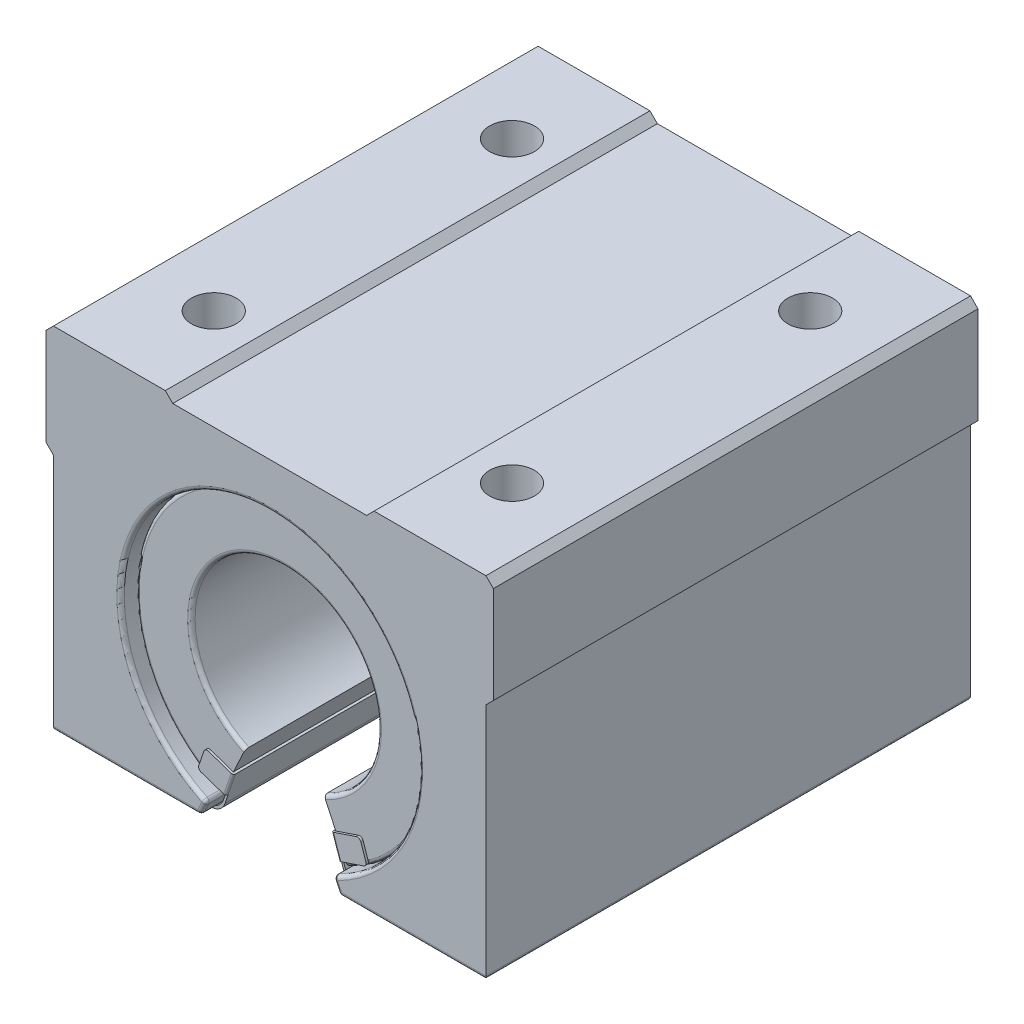
from build123d import *

# Parameters (mm, degrees)
SKETCH2_W                  = 60
SKETCH2_H                  = 47
BOSS_EXTRUDE1_DEPTH        = 65
SKETCH3_W                  = 1
SKETCH3_H                  = 33
SKETCH3_W_2                = 28
SKETCH3_H_2                = 1
CUT_EXTRUDE1_DEPTH         = 65
CUT_EXTRUDE2_DEPTH         = 65
FILLET1_R                  = 0.5
CHAMFER1_SIZE              = 1
SKETCH7_R                  = 3
CUT_EXTRUDE4_DEPTH         = 12
BOSS_EXTRUDE2_DEPTH        = 30.5
BOSS_EXTRUDE2_DEPTH_BACK   = 30.5
FILLET2_R                  = 0.5
BOSS_EXTRUDE4_DEPTH        = 30.5
BOSS_EXTRUDE4_DEPTH_BACK   = 30.5
BOSS_EXTRUDE4_2_DEPTH      = 30.5
BOSS_EXTRUDE4_2_DEPTH_BACK = 30.5
FILLET5_R                  = 0.5
FILLET4_R                  = 0.5
BOSS_EXTRUDE9_DEPTH        = 0.3
BOSS_EXTRUDE9_2_DEPTH      = 0.3
FILLET6_R                  = 0.5
FILLET7_R                  = 0.5
FILLET8_R                  = 0.3
FILLET9_R                  = 0.3
BOSS_EXTRUDE13_DEPTH       = 0.3
BOSS_EXTRUDE13_2_DEPTH     = 0.3
FILLET10_R                 = 0.5
FILLET11_R                 = 0.5
FILLET12_R                 = 0.3
FILLET13_R                 = 0.3


with BuildPart() as part:
    # Sketch2 → Boss-Extrude1 (new body)
    with BuildSketch(Plane.XY):
        with Locations((0, 3.5)):
            Rectangle(SKETCH2_W, SKETCH2_H)
    extrude(amount=BOSS_EXTRUDE1_DEPTH)

    # Sketch3 → Cut-Extrude1 (cut)
    with BuildSketch(Plane.XY):
        with Locations((-29.5, -3.5)):
            Rectangle(SKETCH3_W, SKETCH3_H)
        with Locations((29.5, -3.5)):
            Rectangle(SKETCH3_W, SKETCH3_H)
        with Locations((0, 26.5)):
            Rectangle(SKETCH3_W_2, SKETCH3_H_2)
    extrude(amount=CUT_EXTRUDE1_DEPTH, mode=Mode.SUBTRACT)

    # Sketch4 → Cut-Extrude2 (cut)
    with BuildSketch(Plane.XY):
        with BuildLine():
            Line((-9.326153163, -20), (-8.452365235, -18.126155741))
            ThreePointArc((-8.452365235, -18.126155741), (0, 20), (8.452365235, -18.126155741))
            Line((8.452365235, -18.126155741), (9.326153163, -20))
            Line((9.326153163, -20), (-9.326153163, -20))
        make_face()
    extrude(amount=CUT_EXTRUDE2_DEPTH, mode=Mode.SUBTRACT)

    # Fillet1
    fillet1_edges = [part.edges().sort_by_distance(p)[0] for p in [
        (-19.163076582, -20, 0),
        (-19.163076582, -20, 65),
        (-29, -20, 32.5),
        (29, -20, 32.5),
        (19.163076582, -20, 0),
        (19.163076582, -20, 65),
        (0, 20, 0),
        (8.452365235, -18.126155741, 32.5),
        (-8.889259199, -19.06307787, 0),
        (-8.452365235, -18.126155741, 32.5),
        (-9.326153163, -20, 32.5),
        (8.889259199, -19.06307787, 0),
        (9.326153163, -20, 32.5),
        (0, 20, 65),
        (-8.889259199, -19.06307787, 65),
        (8.889259199, -19.06307787, 65),
    ]]
    fillet(fillet1_edges, radius=FILLET1_R)

    # Chamfer1
    chamfer1_edges = [part.edges().sort_by_distance(p)[0] for p in [
        (14, 26, 32.5),
        (-14, 26, 32.5),
        (-29, 13, 32.5),
        (29, 13, 32.5),
        (-30, 27, 32.5),
        (30, 27, 32.5),
    ]]
    chamfer(chamfer1_edges, length=CHAMFER1_SIZE - 0.0001)  # a hair under: the kernel refuses the full size

    # Sketch7 → Cut-Extrude4 (cut)
    with BuildSketch(Plane(origin=(0, 27, 0), x_dir=(1, 0, 0), z_dir=(0, 1, 0))):
        with Locations(Location((-20, -12.5, 0), (0, 0, 180))):
            Circle(SKETCH7_R)
        with Locations(Location((20, -12.5, 0), (0, 0, 180))):
            Circle(SKETCH7_R)
        with Locations(Location((-20, -52.5, 0), (0, 0, 180))):
            Circle(SKETCH7_R)
        with Locations(Location((20, -52.5, 0), (0, 0, 180))):
            Circle(SKETCH7_R)
    extrude(amount=-CUT_EXTRUDE4_DEPTH, mode=Mode.SUBTRACT)


with BuildPart() as body_2:
    # Sketch8 → Boss-Extrude2 (new, two sides: drawn at the far end of the back side and taken through both)
    with BuildSketch(Plane.XY.offset(32.5).offset(-BOSS_EXTRUDE2_DEPTH_BACK)):
        with BuildLine():
            Line((-8.452365235, -18.126155741), (-5.282728272, -11.328847338))
            ThreePointArc((-5.282728272, -11.328847338), (0, 12.5), (5.282728272, -11.328847338))
            Line((5.282728272, -11.328847338), (8.452365235, -18.126155741))
            ThreePointArc((8.452365235, -18.126155741), (0, 20), (-8.452365235, -18.126155741))
        make_face()
    extrude(amount=BOSS_EXTRUDE2_DEPTH + BOSS_EXTRUDE2_DEPTH_BACK)

    # Fillet2
    fillet2_edges = [body_2.edges().sort_by_distance(p)[0] for p in [
        (0, 20, 63),
        (0, 12.5, 2),
        (0, 12.5, 63),
        (0, 20, 2),
    ]]
    fillet(fillet2_edges, radius=FILLET2_R)


with BuildPart() as body_3:
    # Sketch9 → Boss-Extrude4 (new, two sides: drawn at the far end of the back side and taken through both)
    with BuildSketch(Plane.XY.offset(32.5).offset(-BOSS_EXTRUDE4_DEPTH_BACK)):
        with BuildLine():
            Line((-23, -20), (-10.093304707, -20))
            ThreePointArc((-10.093304707, -20), (-8.928871556, -19.626067476), (-8.199857832, -18.644095435))
            Line((-8.199857832, -18.644095435), (-6.867546753, -14.727501539))
            Line((-6.867546753, -14.727501539), (-6.583529722, -14.824115855))
            Line((-6.583529722, -14.824115855), (-7.985026682, -18.944095435))
            ThreePointArc((-7.985026682, -18.944095435), (-8.714040406, -19.926067476), (-9.878473558, -20.3))
            Line((-9.878473558, -20.3), (-23, -20.3))
            Line((-23, -20.3), (-23, -20))
        make_face()
    extrude(amount=BOSS_EXTRUDE4_DEPTH + BOSS_EXTRUDE4_DEPTH_BACK)

    # Fillet4
    fillet4_edges = [body_3.edges().sort_by_distance(p)[0] for p in [
        (-23, -20.15, 63),
        (-23, -20.15, 2),
    ]]
    fillet(fillet4_edges, radius=FILLET4_R)


with BuildPart() as body_4:
    # Sketch9 → Boss-Extrude4 2 (new, two sides: drawn at the far end of the back side and taken through both)
    with BuildSketch(Plane.XY.offset(32.5).offset(-BOSS_EXTRUDE4_2_DEPTH_BACK)):
        with BuildLine():
            Line((23, -20), (23, -20.3))
            Line((23, -20.3), (9.878473558, -20.3))
            ThreePointArc((9.878473558, -20.3), (8.714040406, -19.926067476), (7.985026682, -18.944095435))
            Line((7.985026682, -18.944095435), (6.583529722, -14.824115855))
            Line((6.583529722, -14.824115855), (6.867546753, -14.727501539))
            Line((6.867546753, -14.727501539), (8.199857832, -18.644095435))
            ThreePointArc((8.199857832, -18.644095435), (8.928871556, -19.626067476), (10.093304707, -20))
            Line((10.093304707, -20), (23, -20))
        make_face()
    extrude(amount=BOSS_EXTRUDE4_2_DEPTH + BOSS_EXTRUDE4_2_DEPTH_BACK)

    # Fillet5
    fillet5_edges = [body_4.edges().sort_by_distance(p)[0] for p in [
        (23, -20.15, 2),
        (23, -20.15, 63),
    ]]
    fillet(fillet5_edges, radius=FILLET5_R)


with BuildPart() as body_5:
    # Sketch11 → Boss-Extrude9 (new body)
    with BuildSketch(Plane.XY.offset(2)):
        Polygon((-6.583529722, -14.824115855), (-10.370423473, -13.535924985), (-11.364294377, -16.457606549), (-7.577400626, -17.745797419), align=None)
    extrude(amount=-BOSS_EXTRUDE9_DEPTH)

    # Fillet7
    fillet7_edges = [body_5.edges().sort_by_distance(p)[0] for p in [
        (-11.364294377, -16.457606549, 1.85),
        (-10.370423473, -13.535924985, 1.85),
    ]]
    fillet(fillet7_edges, radius=FILLET7_R)

    # Fillet9
    fillet9_edges = [body_5.edges().sort_by_distance(p)[0] for p in [
        (-7.080465174, -16.284956637, 1.7),
    ]]
    fillet(fillet9_edges, radius=FILLET9_R - 0.0001)  # a hair under: the kernel refuses the full size


with BuildPart() as body_6:
    # Sketch11 → Boss-Extrude9 2 (new body)
    with BuildSketch(Plane.XY.offset(2)):
        Polygon((6.583529722, -14.824115855), (10.370423473, -13.535924985), (11.364294377, -16.457606549), (7.577400626, -17.745797419), align=None)
    extrude(amount=-BOSS_EXTRUDE9_2_DEPTH)

    # Fillet6
    fillet6_edges = [body_6.edges().sort_by_distance(p)[0] for p in [
        (10.370423473, -13.535924985, 1.85),
        (11.364294377, -16.457606549, 1.85),
    ]]
    fillet(fillet6_edges, radius=FILLET6_R)

    # Fillet8
    fillet8_edges = [body_6.edges().sort_by_distance(p)[0] for p in [
        (7.080465174, -16.284956637, 1.7),
    ]]
    fillet(fillet8_edges, radius=FILLET8_R - 0.0001)  # a hair under: the kernel refuses the full size


with BuildPart() as body_7:
    # Sketch13 → Boss-Extrude13 (new body)
    with BuildSketch(Plane.XY.offset(63)):
        Polygon((-6.583529722, -14.824115855), (-7.577400626, -17.745797419), (-11.364294377, -16.457606549), (-10.370423473, -13.535924985), align=None)
    extrude(amount=BOSS_EXTRUDE13_DEPTH)

    # Fillet11
    fillet11_edges = [body_7.edges().sort_by_distance(p)[0] for p in [
        (-11.364294377, -16.457606549, 63.15),
        (-10.370423473, -13.535924985, 63.15),
    ]]
    fillet(fillet11_edges, radius=FILLET11_R)

    # Fillet12
    fillet12_edges = [body_7.edges().sort_by_distance(p)[0] for p in [
        (-7.080465174, -16.284956637, 63.3),
    ]]
    fillet(fillet12_edges, radius=FILLET12_R - 0.0001)  # a hair under: the kernel refuses the full size


with BuildPart() as body_8:
    # Sketch13 → Boss-Extrude13 2 (new body)
    with BuildSketch(Plane.XY.offset(63)):
        Polygon((6.583529722, -14.824115855), (7.577400626, -17.745797419), (11.364294377, -16.457606549), (10.370423473, -13.535924985), align=None)
    extrude(amount=BOSS_EXTRUDE13_2_DEPTH)

    # Fillet10
    fillet10_edges = [body_8.edges().sort_by_distance(p)[0] for p in [
        (10.370423473, -13.535924985, 63.15),
        (11.364294377, -16.457606549, 63.15),
    ]]
    fillet(fillet10_edges, radius=FILLET10_R)

    # Fillet13
    fillet13_edges = [body_8.edges().sort_by_distance(p)[0] for p in [
        (7.080465174, -16.284956637, 63.3),
    ]]
    fillet(fillet13_edges, radius=FILLET13_R - 0.0001)  # a hair under: the kernel refuses the full size


solid = Compound([part.part, body_2.part, body_3.part, body_4.part, body_5.part, body_6.part, body_7.part, body_8.part])
